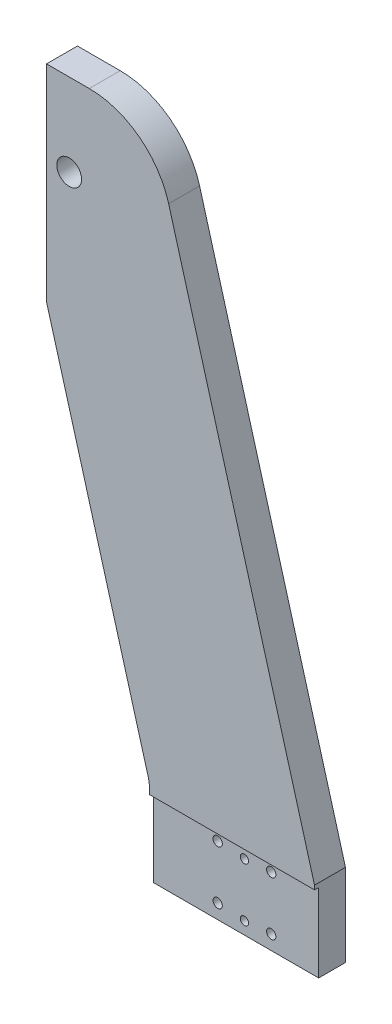
from build123d import *

# Parameters (mm, degrees)
SALIENTE_EXTRUIR1_DEPTH                              = 15
CROQUIS2_R                                           = 6
CORTAR_EXTRUIR1_DEPTH                                = 331.189339622
PERFORADOR_PARA_ROSCAR_PARA_MACHO_DE_ROS_D           = 3.3
PERFORADOR_PARA_ROSCAR_PARA_MACHO_DE_ROS_DEPTH       = 7
PERFORADOR_PARA_ROSCAR_PARA_MACHO_DE_ROS_TIP         = 0.991420021
CROQUIS9_W                                           = 80
CROQUIS9_H                                           = 38
CORTAR_EXTRUIR2_DEPTH                                = 2
TALADROS_DE_ESPIGA_DE_4_0MM1_D                       = 4
TALADROS_DE_ESPIGA_DE_4_0MM1_DEPTH                   = 17
TALADROS_DE_ESPIGA_DE_4_0MM1_TIP                     = 1.201721238
TALADRO_ROSCADO_M41_D                                = 3.3
TALADRO_ROSCADO_M41_DEPTH                            = 11.5
TALADRO_ROSCADO_M41_TIP                              = 0.991420021
REFRENTADO_PARA_TORNILLO_CON_CABEZA_HUEC_D           = 4.5
REFRENTADO_PARA_TORNILLO_CON_CABEZA_HUEC_CBORE_D     = 8
REFRENTADO_PARA_TORNILLO_CON_CABEZA_HUEC_CBORE_DEPTH = 4.4
TALADROS_DE_ESPIGA_DE_4_0MM2_D                       = 4


with BuildPart() as part:
    # Croquis1 → Saliente-Extruir1 (new body)
    with BuildSketch(Plane.XY):
        with BuildLine():
            Line((80, 0), (80, 40))
            Line((80, 40), (9.228509485, 290.860669242))
            ThreePointArc((9.228509485, 290.860669242), (-5.12786552, 311.893782856), (-29.268839302, 320))
            Line((-29.268839302, 320), (-50, 320))
            Line((-50, 320), (-50, 220))
            Line((-50, 220), (-0.751325607, 45.430334621))
            ThreePointArc((-0.751325607, 45.430334621), (-0.1887218, 42.741031935), (0, 40))
            Line((0, 40), (0, 0))
            Line((0, 0), (80, 0))
        make_face()
    extrude(amount=SALIENTE_EXTRUIR1_DEPTH)

    # Croquis2 → Cortar-Extruir1 (cut, through all)
    with BuildSketch(Plane(origin=(0, 0, 0), x_dir=(-1, 0, 0), z_dir=(0, 0, -1))):
        with Locations((39, 280)):
            Circle(CROQUIS2_R)
    extrude(amount=-CORTAR_EXTRUIR1_DEPTH, mode=Mode.SUBTRACT)

    # Perforador para roscar para macho de roscar para M44
    with Locations(Plane(origin=(0, 0, 0), x_dir=(-1, 0, 0), z_dir=(0, 0, -1))):
        with Locations((39, 261.75), (39, 298.25)):
            Hole(PERFORADOR_PARA_ROSCAR_PARA_MACHO_DE_ROS_D / 2, depth=PERFORADOR_PARA_ROSCAR_PARA_MACHO_DE_ROS_DEPTH)
            with Locations((0, 0, -(PERFORADOR_PARA_ROSCAR_PARA_MACHO_DE_ROS_DEPTH + PERFORADOR_PARA_ROSCAR_PARA_MACHO_DE_ROS_TIP / 2))):  # 118° drill point
                Cone(0, PERFORADOR_PARA_ROSCAR_PARA_MACHO_DE_ROS_D / 2, PERFORADOR_PARA_ROSCAR_PARA_MACHO_DE_ROS_TIP, mode=Mode.SUBTRACT)

    # Croquis9 → Cortar-Extruir2 (cut)
    with BuildSketch(Plane.XY.offset(15)):
        with Locations((40, 19)):
            Rectangle(CROQUIS9_W, CROQUIS9_H)
    extrude(amount=-CORTAR_EXTRUIR2_DEPTH, mode=Mode.SUBTRACT)

    # Taladros de espiga de Ø4.0mm1
    with Locations(Plane.ZY.offset(50)):
        with Locations((6, 294), (6, 266)):
            Hole(TALADROS_DE_ESPIGA_DE_4_0MM1_D / 2, depth=TALADROS_DE_ESPIGA_DE_4_0MM1_DEPTH)
            with Locations((0, 0, -(TALADROS_DE_ESPIGA_DE_4_0MM1_DEPTH + TALADROS_DE_ESPIGA_DE_4_0MM1_TIP / 2))):  # 118° drill point
                Cone(0, TALADROS_DE_ESPIGA_DE_4_0MM1_D / 2, TALADROS_DE_ESPIGA_DE_4_0MM1_TIP, mode=Mode.SUBTRACT)

    # Taladro roscado M41
    with Locations(Plane.ZY.offset(50)):
        with Locations((6, 305), (6, 255)):
            Hole(TALADRO_ROSCADO_M41_D / 2, depth=TALADRO_ROSCADO_M41_DEPTH)
            with Locations((0, 0, -(TALADRO_ROSCADO_M41_DEPTH + TALADRO_ROSCADO_M41_TIP / 2))):  # 118° drill point
                Cone(0, TALADRO_ROSCADO_M41_D / 2, TALADRO_ROSCADO_M41_TIP, mode=Mode.SUBTRACT)

    # Refrentado para tornillo con cabeza hueca de M41 (through all)
    with Locations(Plane(origin=(0, 0, 0), x_dir=(-1, 0, 0), z_dir=(0, 0, -1))):
        with Locations((-57, 7), (-57, 33), (-31, 33), (-31, 7)):
            CounterBoreHole(REFRENTADO_PARA_TORNILLO_CON_CABEZA_HUEC_D / 2, REFRENTADO_PARA_TORNILLO_CON_CABEZA_HUEC_CBORE_D / 2, REFRENTADO_PARA_TORNILLO_CON_CABEZA_HUEC_CBORE_DEPTH)

    # Taladros de espiga de Ø4.0mm2 (through all)
    with Locations(Plane(origin=(0, 0, 0), x_dir=(-1, 0, 0), z_dir=(0, 0, -1))):
        with Locations((-44, 32), (-44, 6)):
            Hole(TALADROS_DE_ESPIGA_DE_4_0MM2_D / 2)


solid = part.part
